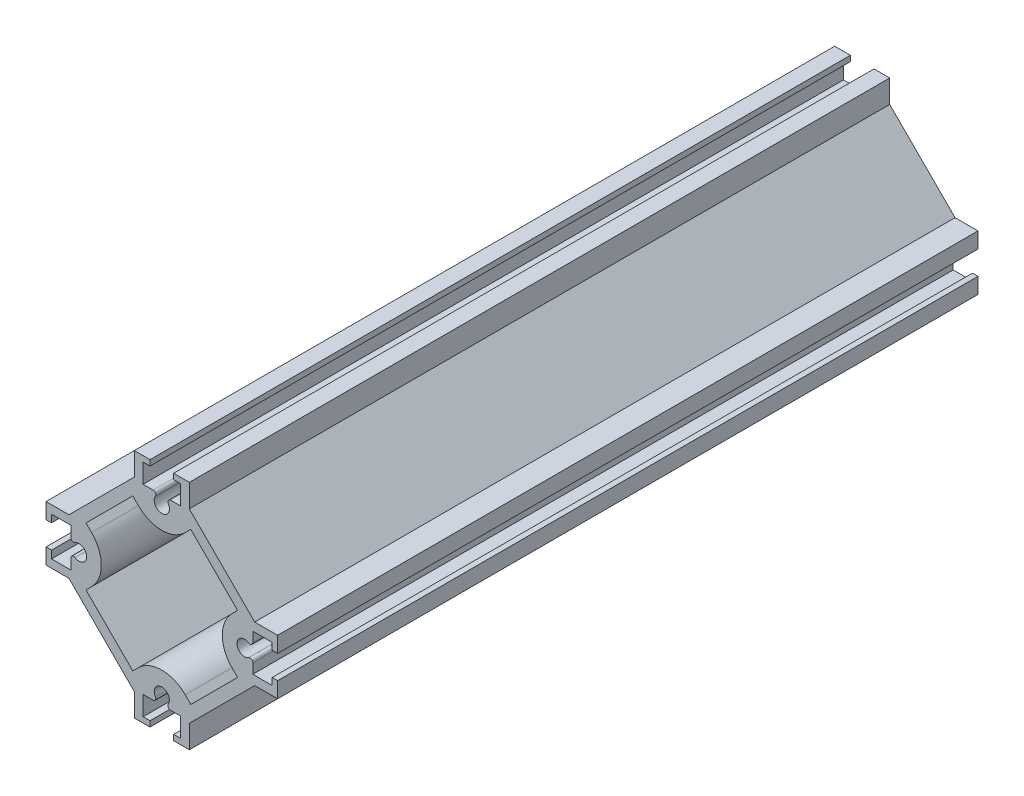
from build123d import *

# Parameters (mm, degrees)
BOSS_EXTRUDE1_DEPTH = 127
BOSS_EXTRUDE4_DEPTH = 127
SKETCH7_R           = 1.375
SKETCH7_R_2         = 1.375000009
SKETCH7_R_3         = 1.374999997
SKETCH7_W           = 3.5
SKETCH7_H           = 7.028015283
SKETCH7_W_2         = 6.780603604
SKETCH7_H_2         = 3.5
SKETCH7_H_3         = 6.780603604
CUT_EXTRUDE2_DEPTH  = 131.426224357
SKETCH8_W           = 2.834613859
SKETCH8_H           = 1
SKETCH8_W_2         = 1
SKETCH8_H_2         = 2.748258962
SKETCH8_W_3         = 3.182807673
SKETCH8_H_3         = 2.560440129
CUT_EXTRUDE3_DEPTH  = 131.426224357
FILLET3_R           = 0.5
FILLET4_R           = 0.5
BOSS_EXTRUDE6_DEPTH = 127
FILLET5_R           = 6


# Some blends are built 0.0001 mm under size
with BuildPart() as part:
    # Sketch1 → Boss-Extrude1 (new body)
    with BuildSketch(Plane.XY):
        Polygon((4.990301802, 16.842973424), (16.842973424, 4.990301802), (16.842973424, -4.990301802), (4.990301802, -16.842973424), (-4.990301802, -16.842973424), (-16.842973424, -4.990301802), (-16.842973424, 4.990301802), (-4.990301802, 16.842973424), align=None)
        with BuildLine():
            Line((-13.745064738, 5.259783364), (-5.259783364, 13.745064738))
            ThreePointArc((-5.259783364, 13.745064738), (0, 11.566391134), (5.259783364, 13.745064738))
            Line((5.259783364, 13.745064738), (13.745064738, 5.259783364))
            ThreePointArc((13.745064738, 5.259783364), (11.566391134, 0), (13.745064738, -5.259783364))
            Line((13.745064738, -5.259783364), (5.259783364, -13.745064738))
            ThreePointArc((5.259783364, -13.745064738), (0, -11.566391134), (-5.259783364, -13.745064738))
            Line((-5.259783364, -13.745064738), (-13.745064738, -5.259783364))
            ThreePointArc((-13.745064738, -5.259783364), (-11.566391134, 0), (-13.745064738, 5.259783364))
        make_face(mode=Mode.SUBTRACT)
    extrude(amount=BOSS_EXTRUDE1_DEPTH)

    # Sketch5 → Boss-Extrude4 (add, through all)
    with BuildSketch(Plane.XY.offset(127)):
        Polygon((-16.842973424, -4.990301802), (-21, -4.990301802), (-21, -2.140301802), (-20, -2.140301802), (-20, -3.513722258), (-16.842973424, -3.513722258), align=None)
        Polygon((-16.842973424, 4.990301802), (-21, 4.990301802), (-21, 2.140301802), (-20, 2.140301802), (-20, 3.514293025), (-16.842973424, 3.514293025), align=None)
        Polygon((16.842973424, 4.990301802), (21, 4.990301802), (21, 2.140301802), (20, 2.140301802), (20, 3.390301802), (16.842973424, 3.390301802), align=None)
        Polygon((21, -4.990301802), (16.842973424, -4.990301802), (16.842973424, -3.390301802), (20, -3.390301802), (20, -2.140301802), (21, -2.140301802), align=None)
        Polygon((3.390301802, 16.842973424), (4.990301802, 16.842973424), (4.990301802, 21), (2.140301802, 21), (2.140301802, 20), (3.390301802, 20), align=None)
        Polygon((-4.990301802, 16.842973424), (-4.990301802, 21), (-2.140301802, 21), (-2.140301802, 20), (-3.390301802, 20), (-3.390301802, 16.842973424), align=None)
        Polygon((4.990301802, -16.842973424), (4.990301802, -21), (2.140301802, -21), (2.140301802, -20), (3.390301802, -20), (3.390301802, -16.842973424), align=None)
        Polygon((-4.990301802, -16.842973424), (-4.990301802, -21), (-2.140301802, -21), (-2.140301802, -20), (-3.390301802, -20), (-3.390301802, -16.842973424), align=None)
    extrude(amount=-BOSS_EXTRUDE4_DEPTH)

    # Sketch7 → Cut-Extrude2 (cut, through all)
    with BuildSketch(Plane.XY):
        with Locations(Location((-15.004848102, 0, 0), (0, 0, 180))):
            Circle(SKETCH7_R)
        with Locations(Location((3e-09, 15.004848102, 0), (0, 0, 180))):
            Circle(SKETCH7_R)
        with Locations(Location((15.004848102, -2.203e-06, 0), (0, 0, 180))):
            Circle(SKETCH7_R_2)
        with Locations(Location((0, -15.004848102, 0), (0, 0, 180))):
            Circle(SKETCH7_R_3)
        with Locations((-18.25, 0.000285384)):
            Rectangle(SKETCH7_W, SKETCH7_H)
        with Locations((0, 18.25)):
            Rectangle(SKETCH7_W_2, SKETCH7_H_2)
        with Locations((18.25, 0)):
            Rectangle(SKETCH7_W, SKETCH7_H_3)
        with Locations((0, -18.25)):
            Rectangle(SKETCH7_W_2, SKETCH7_H_2)
    extrude(amount=CUT_EXTRUDE2_DEPTH, mode=Mode.SUBTRACT)

    # Sketch8 → Cut-Extrude3 (cut, through all)
    with BuildSketch(Plane.XY.offset(127)):
        with Locations((-16.422155032, 0)):
            Rectangle(SKETCH8_W, SKETCH8_H)
        with Locations((0, 16.378977583)):
            Rectangle(SKETCH8_W_2, SKETCH8_H_2)
        with Locations((16.596251939, 0)):
            Rectangle(SKETCH8_W_3, SKETCH8_H)
        with Locations((0, -16.285068167)):
            Rectangle(SKETCH8_W_2, SKETCH8_H_3)
    extrude(amount=-CUT_EXTRUDE3_DEPTH, mode=Mode.SUBTRACT)

    # Fillet3
    # the kernel refuses this fillet: 0.5 mm, written as the material it takes off along each edge
    with BuildSketch(Plane(origin=(-16.5, 0.5, -1.025810125), x_dir=(0, 1, 0), z_dir=(0, 0, 1))) as fillet3_piece_1:
        with BuildLine():
            CenterArc((0.41032405, -0.5), FILLET3_R, 90, 55.149723763)
            Line((0, -0.214283053), (-0.008206481, -0.208568714))
            ThreePointArc((-0.008206481, -0.208568714), (-0.01, -0.107141526), (-0.01, 0))
            Line((-0.01, 0), (0, 0.01))
            Line((0, 0.01), (0.41032405, 0.01))
            Line((0.41032405, 0.01), (0.41032405, 0))
        make_face()
    extrude(amount=129.05162025, mode=Mode.SUBTRACT)
    with BuildSketch(Plane(origin=(0.5, -16.5, -1.02581013), x_dir=(5.296643708926083e-12, 1.0, 0), z_dir=(0, 0, 1))) as fillet3_piece_2:
        with BuildLine():
            CenterArc((0.5, -0.410324052), FILLET3_R, 124.850275833, 55.149724167)
            Line((0, -0.410324052), (-0.01, -0.410324052))
            Line((-0.01, -0.410324052), (-0.01, 0))
            Line((-0.01, 0), (0, 0.01))
            ThreePointArc((0, 0.01), (0.107141528, 0.01), (0.208568717, 0.008206481))
            Line((0.208568717, 0.008206481), (0.214283056, 0))
        make_face()
    extrude(amount=129.05162026, mode=Mode.SUBTRACT)
    with BuildSketch(Plane(origin=(-0.5, -16.5, 128.02581013), x_dir=(-1, 0, 0), z_dir=(0, 0, -1))) as fillet3_piece_3:
        with BuildLine():
            CenterArc((0.410324052, 0.5), FILLET3_R, 214.850275833, 55.149724167)
            Line((0, 0.214283056), (-0.008206481, 0.208568717))
            ThreePointArc((-0.008206481, 0.208568717), (-0.01, 0.107141528), (-0.01, 0))
            Line((-0.01, 0), (0, -0.01))
            Line((0, -0.01), (0.410324052, -0.01))
            Line((0.410324052, -0.01), (0.410324052, 0))
        make_face()
    extrude(amount=129.05162026, mode=Mode.SUBTRACT)
    with BuildSketch(Plane(origin=(16.5, -0.5, -1.025808612), x_dir=(0, -1, 0), z_dir=(0, 0, 1))) as fillet3_piece_4:
        with BuildLine():
            CenterArc((0.410323445, -0.5), FILLET3_R, 90, 55.149602377)
            Line((0, -0.214282183), (-0.008206469, -0.208567827))
            ThreePointArc((-0.008206469, -0.208567827), (-0.01, -0.107141092), (-0.01, 0))
            Line((-0.01, 0), (0, 0.01))
            Line((0, 0.01), (0.410323445, 0.01))
            Line((0.410323445, 0.01), (0.410323445, 0))
        make_face()
    extrude(amount=129.051617223, mode=Mode.SUBTRACT)
    with BuildSketch(Plane(origin=(16.5, 0.5, 128.025811605), x_dir=(-1.0, 5.295068435052625e-12, 0), z_dir=(0, 0, -1))) as fillet3_piece_5:
        with BuildLine():
            CenterArc((0.5, 0.410324642), FILLET3_R, 180, 55.149842509)
            Line((0, 0.410324642), (-0.01, 0.410324642))
            Line((-0.01, 0.410324642), (-0.01, 0))
            Line((-0.01, 0), (0, -0.01))
            ThreePointArc((0, -0.01), (0.107141952, -0.01), (0.208569581, -0.008206493))
            Line((0.208569581, -0.008206493), (0.214283903, 0))
        make_face()
    extrude(amount=129.051623211, mode=Mode.SUBTRACT)
    with BuildSketch(Plane(origin=(-0.5, 16.5, -1.025810127), x_dir=(-5.291980756940643e-12, -1.0, 0), z_dir=(0, 0, 1))) as fillet3_piece_6:
        with BuildLine():
            CenterArc((0.5, -0.410324051), FILLET3_R, 124.850276074, 55.149723926)
            Line((0, -0.410324051), (-0.01, -0.410324051))
            Line((-0.01, -0.410324051), (-0.01, 0))
            Line((-0.01, 0), (0, 0.01))
            ThreePointArc((0, 0.01), (0.107141527, 0.01), (0.208568715, 0.008206481))
            Line((0.208568715, 0.008206481), (0.214283054, 0))
        make_face()
    extrude(amount=129.051620254, mode=Mode.SUBTRACT)
    with BuildSketch(Plane(origin=(0.5, 16.5, 128.025810123), x_dir=(1, 0, 0), z_dir=(0, 0, -1))) as fillet3_piece_7:
        with BuildLine():
            CenterArc((0.410324049, 0.5), FILLET3_R, 214.8502764, 55.1497236)
            Line((0, 0.214283051), (-0.008206481, 0.208568713))
            ThreePointArc((-0.008206481, 0.208568713), (-0.01, 0.107141526), (-0.01, 0))
            Line((-0.01, 0), (0, -0.01))
            Line((0, -0.01), (0.410324049, -0.01))
            Line((0.410324049, -0.01), (0.410324049, 0))
        make_face()
    extrude(amount=129.051620246, mode=Mode.SUBTRACT)
    with BuildSketch(Plane(origin=(-16.5, -0.5, 128.025810125), x_dir=(1.0, -5.296125669893669e-12, 0), z_dir=(0, 0, -1))) as fillet3_piece_8:
        with BuildLine():
            CenterArc((0.5, 0.41032405), FILLET3_R, 180, 55.149723763)
            Line((0, 0.41032405), (-0.01, 0.41032405))
            Line((-0.01, 0.41032405), (-0.01, 0))
            Line((-0.01, 0), (0, -0.01))
            ThreePointArc((0, -0.01), (0.107141526, -0.01), (0.208568714, -0.008206481))
            Line((0.208568714, -0.008206481), (0.214283053, 0))
        make_face()
    extrude(amount=129.05162025, mode=Mode.SUBTRACT)

    # Fillet4
    fillet4_edges = [part.edges().sort_by_distance(p)[0] for p in [
        (-16.285716947, 0.5, 63.5),
        (0.5, -16.285716944, 63.5),
        (-0.5, -16.285716944, 63.5),
        (16.285717817, -0.5, 63.5),
        (16.285716097, 0.5, 63.5),
        (-0.5, 16.285716946, 63.5),
        (0.5, 16.285716949, 63.5),
        (-16.285716947, -0.5, 63.5),
    ]]
    fillet(fillet4_edges, radius=FILLET4_R - 0.0001)  # a hair under: the kernel refuses the full size

    # Sketch9 → Boss-Extrude6 (add, through all)
    with BuildSketch(Plane.XY.offset(127)):
        with BuildLine():
            Line((-4.990301802, 16.842973424), (-16.842973424, 4.990301802))
            ThreePointArc((-16.842973424, 4.990301802), (-11.852671623, 0), (-16.842973424, -4.990301802))
            Line((-16.842973424, -4.990301802), (-4.990301802, -16.842973424))
            ThreePointArc((-4.990301802, -16.842973424), (0, -11.852671623), (4.990301802, -16.842973424))
            Line((4.990301802, -16.842973424), (16.842973424, -4.990301802))
            ThreePointArc((16.842973424, -4.990301802), (11.852671623, 0), (16.842973424, 4.990301802))
            Line((16.842973424, 4.990301802), (4.990301802, 16.842973424))
            ThreePointArc((4.990301802, 16.842973424), (0, 11.852671623), (-4.990301802, 16.842973424))
        make_face()
        Polygon((-5.259783364, 13.745064738), (-13.745064738, 5.259783364), (-8.485281374, 0), (-13.745064738, -5.259783364), (-5.259783364, -13.745064738), (0, -8.485281374), (5.259783364, -13.745064738), (13.745064738, -5.259783364), (8.485281374, 0), (13.745064738, 5.259783364), (5.259783364, 13.745064738), (0, 8.485281374), align=None, mode=Mode.SUBTRACT)
    extrude(amount=-BOSS_EXTRUDE6_DEPTH)

    # Fillet5
    fillet5_edges = [part.edges().sort_by_distance(p)[0] for p in [
        (0, 8.485281374, 63.5),
        (8.485281374, 0, 63.5),
        (0, -8.485281374, 63.5),
        (-8.485281374, 0, 63.5),
    ]]
    fillet(fillet5_edges, radius=FILLET5_R)


solid = part.part
